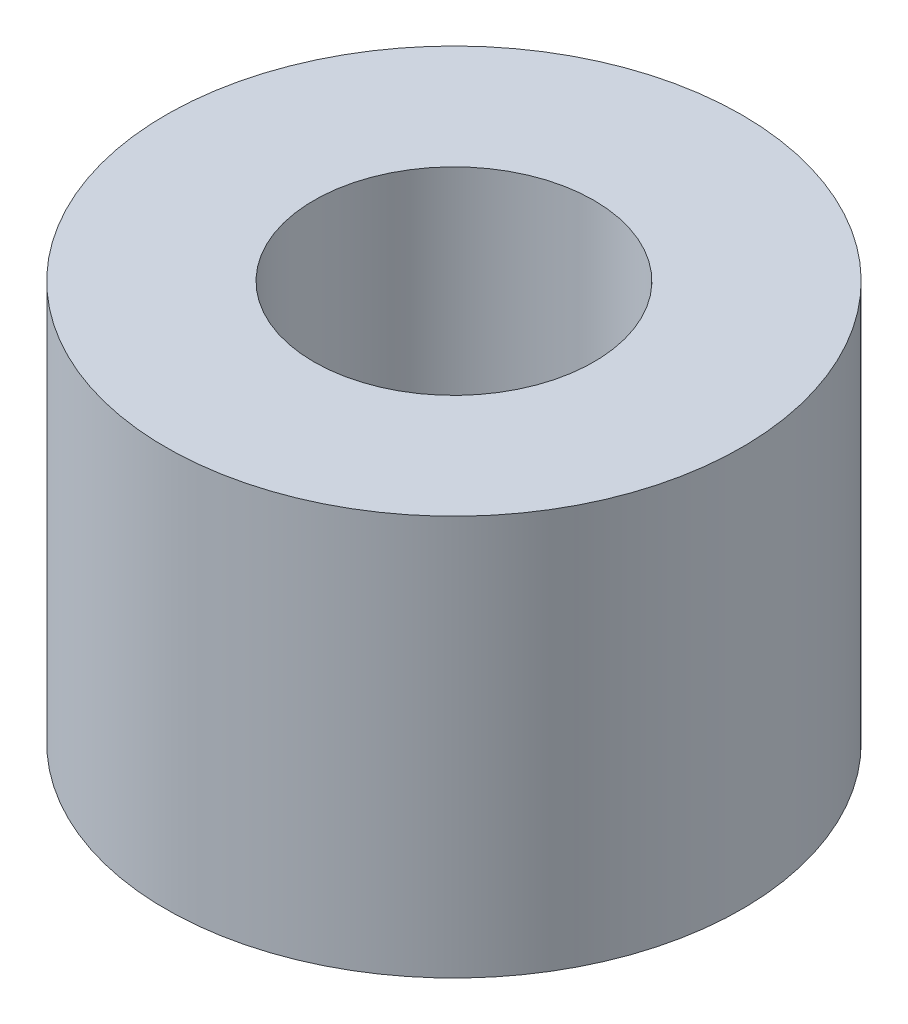
from build123d import *

# Parameters (mm, degrees)
SKETCH1_R        = 4.572
SKETCH1_R_2      = 2.2225
EXTRUSION1_DEPTH = 6.35


with BuildPart() as part:
    # Sketch1 → Extrusion1 (new body)
    with BuildSketch(Plane(origin=(0, 0, 0), x_dir=(-1, 0, 0), z_dir=(0, 1, 0))):
        Circle(SKETCH1_R)
        Circle(SKETCH1_R_2, mode=Mode.SUBTRACT)
    extrude(amount=EXTRUSION1_DEPTH)


solid = part.part
